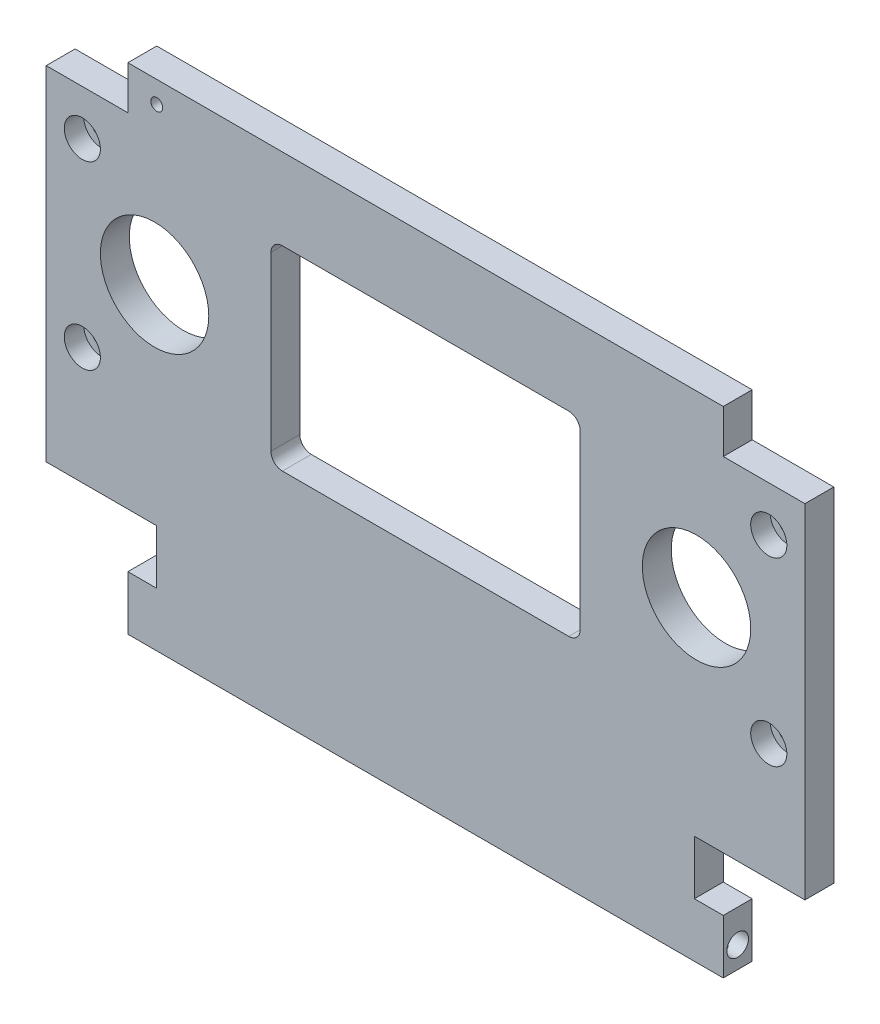
from build123d import *

# Parameters (mm, degrees)
SKETCH_1_W                   = 210
SKETCH_1_H                   = 75
EXTRUDE_1_DEPTH              = 8
CUT_EXTRUDE_1_DEPTH          = 224.134488594
HOLE_WIZARD_M5_1_D           = 5.5
HOLE_WIZARD_M5_1_DEPTH       = 10.1
HOLE_WIZARD_M5_1_CBORE_D     = 10
HOLE_WIZARD_M5_1_CBORE_DEPTH = 5.4
HOLE_WIZARD_M5_1_TIP         = 1.652366702
SKETCH_5_R                   = 15
CUT_EXTRUDE_2_DEPTH          = 13
SKETCH_6_W                   = 210
SKETCH_6_H                   = 8
EXTRUDE_2_DEPTH              = 50
SKETCH_7_W                   = 22.6
SKETCH_7_H                   = 30
CUT_EXTRUDE_3_DEPTH          = 20
SKETCH_9_R                   = 3
CUT_EXTRUDE_5_DEPTH          = 8
SKETCH_12_W                  = 164.8
SKETCH_12_H                  = 8
EXTRUDE_3_DEPTH              = 12
SKETCH_13_W                  = 8
SKETCH_13_H                  = 15
CUT_EXTRUDE_6_DEPTH          = 228.448895359
HOLE_WIZARD_M4_1_D           = 3.3
HOLE_WIZARD_M4_1_DEPTH       = 5
HOLE_WIZARD_M4_1_TIP         = 0.991420021
HOLE_WIZARD_M4_2_D           = 3.3
HOLE_WIZARD_M4_2_DEPTH       = 10.1
HOLE_WIZARD_M4_2_TIP         = 0.991420021


with BuildPart() as part:
    # 草图1 → 凸台-拉伸1 (new body)
    with BuildSketch(Plane.XY):
        with Locations((105, 37.5)):
            Rectangle(SKETCH_1_W, SKETCH_1_H)
    extrude(amount=EXTRUDE_1_DEPTH)

    # 草图2 → 切除-拉伸1 (cut, through all)
    with BuildSketch(Plane.XY.offset(8)):
        with BuildLine():
            Line((144.62, 64.5), (65.38, 64.5))
            ThreePointArc((65.38, 64.5), (63.131400436, 63.568599564), (62.2, 61.32))
            Line((62.2, 61.32), (62.2, 13.68))
            ThreePointArc((62.2, 13.68), (63.131400436, 11.431400436), (65.38, 10.5))
            Line((65.38, 10.5), (144.62, 10.5))
            ThreePointArc((144.62, 10.5), (146.868599564, 11.431400436), (147.8, 13.68))
            Line((147.8, 13.68), (147.8, 61.32))
            ThreePointArc((147.8, 61.32), (146.868599564, 63.568599564), (144.62, 64.5))
        make_face()
    extrude(amount=-CUT_EXTRUDE_1_DEPTH, mode=Mode.SUBTRACT)

    # M5 六角凹头螺钉的柱形沉头孔1
    with Locations(Plane.XY.offset(8)):
        with Locations((10, 62.5), (10, 12.5), (200, 62.5), (200, 12.5)):
            CounterBoreHole(HOLE_WIZARD_M5_1_D / 2, HOLE_WIZARD_M5_1_CBORE_D / 2, HOLE_WIZARD_M5_1_CBORE_DEPTH, depth=HOLE_WIZARD_M5_1_DEPTH)
            with Locations((0, 0, -(HOLE_WIZARD_M5_1_DEPTH + HOLE_WIZARD_M5_1_TIP / 2))):  # 118° drill point
                Cone(0, HOLE_WIZARD_M5_1_D / 2, HOLE_WIZARD_M5_1_TIP, mode=Mode.SUBTRACT)

    # 草图5 → 切除-拉伸2 (cut)
    with BuildSketch(Plane.XY.offset(8)):
        with Locations((30, 37.5)):
            Circle(SKETCH_5_R)
        with Locations((180, 37.5)):
            Circle(SKETCH_5_R)
    extrude(amount=-CUT_EXTRUDE_2_DEPTH, mode=Mode.SUBTRACT)

    # 草图6 → 凸台-拉伸2 (add)
    with BuildSketch(Plane.XZ):
        with Locations((105, 4)):
            Rectangle(SKETCH_6_W, SKETCH_6_H)
    extrude(amount=EXTRUDE_2_DEPTH)

    # 草图7 → 切除-拉伸3 (cut)
    with BuildSketch(Plane.XY.offset(8)):
        with Locations((11.3, -35)):
            Rectangle(SKETCH_7_W, SKETCH_7_H)
        with Locations((198.7, -35)):
            Rectangle(SKETCH_7_W, SKETCH_7_H)
    extrude(amount=-CUT_EXTRUDE_3_DEPTH, mode=Mode.SUBTRACT)

    # 草图9 → 切除-拉伸5 (cut)
    with BuildSketch(Plane.ZY.offset(-22.6)):
        with Locations((3.9960026, -44.027952664)):
            Circle(SKETCH_9_R)
    cut_extrude_5 = extrude(amount=-CUT_EXTRUDE_5_DEPTH, mode=Mode.SUBTRACT)

    # 镜向1: 切除-拉伸5 across plane
    add(cut_extrude_5.mirror(Plane.ZY.offset(-105)), mode=Mode.SUBTRACT)

    # 草图12 → 凸台-拉伸3 (add)
    with BuildSketch(Plane(origin=(0, 75, 0), x_dir=(1, 0, 0), z_dir=(0, 1, 0))):
        with Locations((105, -4)):
            Rectangle(SKETCH_12_W, SKETCH_12_H)
    extrude(amount=EXTRUDE_3_DEPTH)

    # 草图13 → 切除-拉伸6 (cut, through all)
    with BuildSketch(Plane.XY.offset(8)):
        with Locations((26.6, -27.5)):
            Rectangle(SKETCH_13_W, SKETCH_13_H)
        with Locations((183.4, -27.5)):
            Rectangle(SKETCH_13_W, SKETCH_13_H)
    extrude(amount=-CUT_EXTRUDE_6_DEPTH, mode=Mode.SUBTRACT)

    # M4 螺纹孔1
    with Locations(Plane(origin=(0, -50, 0), x_dir=(-1, 0, 0), z_dir=(0, -1, 0))):
        with Locations((-27.6, -4.002197451), (-182.4, -4.002197451)):
            Hole(HOLE_WIZARD_M4_1_D / 2, depth=HOLE_WIZARD_M4_1_DEPTH)
            with Locations((0, 0, -(HOLE_WIZARD_M4_1_DEPTH + HOLE_WIZARD_M4_1_TIP / 2))):  # 118° drill point
                Cone(0, HOLE_WIZARD_M4_1_D / 2, HOLE_WIZARD_M4_1_TIP, mode=Mode.SUBTRACT)

    # M4 螺纹孔2
    with Locations(Plane(origin=(0, 0, 0), x_dir=(-1, 0, 0), z_dir=(0, 0, -1))):
        with Locations((-30.6, 81)):
            Hole(HOLE_WIZARD_M4_2_D / 2, depth=HOLE_WIZARD_M4_2_DEPTH)
            with Locations((0, 0, -(HOLE_WIZARD_M4_2_DEPTH + HOLE_WIZARD_M4_2_TIP / 2))):  # 118° drill point
                Cone(0, HOLE_WIZARD_M4_2_D / 2, HOLE_WIZARD_M4_2_TIP, mode=Mode.SUBTRACT)


solid = part.part
